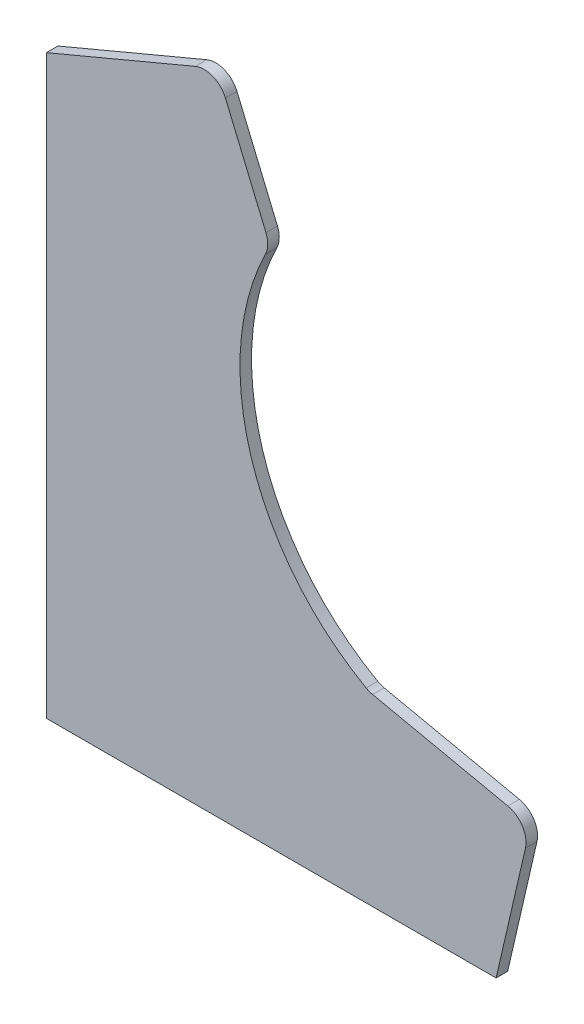
from build123d import *

# Parameters (mm, degrees)
BOSS_EXTRU_1_DEPTH = 10


with BuildPart() as part:
    # Esquisse1 → Boss.-Extru.1 (new body)
    with BuildSketch(Plane.XY):
        with BuildLine():
            Line((0, 0), (0, 500))
            Line((0, 500), (129.062590026, 554.250037842))
            ThreePointArc((129.062590026, 554.250037842), (144.369719008, 554.329896284), (155.249962158, 543.562590026))
            Line((155.249962158, 543.562590026), (190.372911185, 460.003961295))
            ThreePointArc((190.372911185, 460.003961295), (191.926850898, 451.665834452), (189.885391956, 443.433487687))
            ThreePointArc((189.885391956, 443.433487687), (177.495411437, 285.088693671), (277.26935171, 161.509786687))
            ThreePointArc((277.26935171, 161.509786687), (280.000825243, 160.232306321), (282.89331295, 159.380004368))
            Line((282.89331295, 159.380004368), (400.13437653, 134.256919315))
            ThreePointArc((400.13437653, 134.256919315), (412.819999706, 125.433704138), (415.431618669, 110.2036809))
            Line((415.431618669, 110.2036809), (390, 0))
            Line((390, 0), (0, 0))
        make_face()
    extrude(amount=BOSS_EXTRU_1_DEPTH)


solid = part.part
